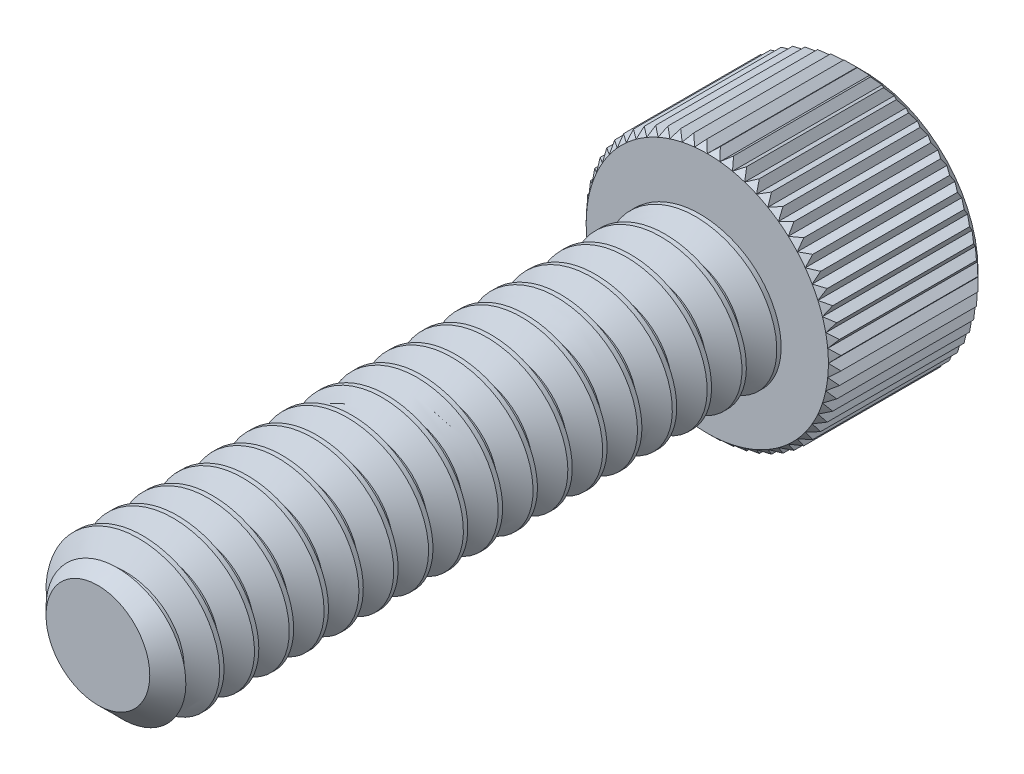
from build123d import *
from build123d.topology import SkipClean

# Parameters (mm, degrees)
SKETCH1_R          = 1.4224
EXTRUDE1_DEPTH     = 11.1125
CHAMFER3_SIZE      = 0.47625
CUT_SWEEP1_PITCH   = 0.635
SKETCH6_R          = 2.3241
EXTRUDE2_DEPTH     = 2.8448
CUT_EXTRUDE1_DEPTH = 1.7859375
CHAMFER1_SIZE      = 0.23241
CHAMFER2_SIZE      = 0.116205
CUT_EXTRUDE3_DEPTH = 12.588379528
CIRPATTERN1_COUNT  = 60


with BuildPart() as part:
    # Sketch1 → Extrude1 (new body)
    with BuildSketch(Plane.XY):
        Circle(SKETCH1_R)
    extrude(amount=-EXTRUDE1_DEPTH)

    # Chamfer3
    chamfer3_edges = [part.edges().sort_by_distance(p)[0] for p in [
        (-1.4224, 0, 0),
    ]]
    chamfer(chamfer3_edges, length=CHAMFER3_SIZE)

    # Cut-Sweep1: the profile of Sketch3 profile screwed along a right-hand helix of 18.5 turns, 6 arcs to a turn; built about Z, then put on its axis
    cut_sweep1_z = Axis((0, 0, 0), (0, 0, 1))
    cut_sweep1_corners = [(1.4227, 0, -0.555798205), (1.009955401, 0, -0.3175), (1.009955401, 0, -0.238125), (1.4227, 0, 0.000173205)]
    with BuildLine(mode=Mode.PRIVATE) as cut_sweep1_profile:
        Line(cut_sweep1_corners[0], cut_sweep1_corners[1])
        Line(cut_sweep1_corners[1], cut_sweep1_corners[2])
        Line(cut_sweep1_corners[2], cut_sweep1_corners[3])
        Line(cut_sweep1_corners[3], cut_sweep1_corners[0])
    cut_sweep1_cap = Face(cut_sweep1_profile.wire())
    cut_sweep1_turn_angles = [0, 30, 60, 90, 120, 150, 180, 210, 240, 270, 300, 330, 360]
    cut_sweep1_turn_weights = [1, 0.8660254037844387, 1, 0.8660254037844387, 1, 0.8660254037844387, 1, 0.8660254037844387, 1, 0.8660254037844387, 1, 0.8660254037844387, 1]
    cut_sweep1_turn_rails = [Edge.make_bspline([Vector(p[0], p[1], 0).rotate(cut_sweep1_z, cut_sweep1_turn_angles[k]) / cut_sweep1_turn_weights[k] + Vector(0, 0, p[2] + CUT_SWEEP1_PITCH * cut_sweep1_turn_angles[k] / 360) for k in range(13)], [0, 0, 0, 1, 1, 2, 2, 3, 3, 4, 4, 5, 5, 6, 6, 6], 2, cut_sweep1_turn_weights) for p in cut_sweep1_corners]
    cut_sweep1_turn_sides = [Face.make_surface_from_curves(cut_sweep1_turn_rails[p[0]], cut_sweep1_turn_rails[p[1]]) for p in [(0, 1), (1, 2), (2, 3), (3, 0)]]
    cut_sweep1_last_angles = [6480, 6510, 6540, 6570, 6600, 6630, 6660]
    cut_sweep1_last_weights = [1, 0.8660254037844387, 1, 0.8660254037844387, 1, 0.8660254037843553, 1]
    cut_sweep1_last_rails = [Edge.make_bspline([Vector(p[0], p[1], 0).rotate(cut_sweep1_z, cut_sweep1_last_angles[k]) / cut_sweep1_last_weights[k] + Vector(0, 0, p[2] + CUT_SWEEP1_PITCH * cut_sweep1_last_angles[k] / 360) for k in range(7)], [0, 0, 0, 1, 1, 2, 2, 3, 3, 3], 2, cut_sweep1_last_weights) for p in cut_sweep1_corners]
    cut_sweep1_last_sides = [Face.make_surface_from_curves(cut_sweep1_last_rails[p[0]], cut_sweep1_last_rails[p[1]]) for p in [(0, 1), (1, 2), (2, 3), (3, 0)]]
    cut_sweep1 = Plane(origin=(0, 0, 0), x_dir=(0, 1, 0), z_dir=(0, 0, -1)) * Solid(Shell([*[p.moved(Location((0, 0, CUT_SWEEP1_PITCH * i))) for i in range(18) for p in cut_sweep1_turn_sides], *cut_sweep1_last_sides, cut_sweep1_cap, cut_sweep1_cap.rotate(cut_sweep1_z, 6660).moved(Location((0, 0, CUT_SWEEP1_PITCH * 6660 / 360)))]))
    add(cut_sweep1, mode=Mode.SUBTRACT)

    # Sketch6 → Extrude2 (add)
    with BuildSketch(Plane(origin=(0, 0, -11.1125), x_dir=(-1, 0, 0), z_dir=(0, 0, -1))):
        Circle(SKETCH6_R)
    extrude(amount=EXTRUDE2_DEPTH)

    # Sketch7 → Cut-Extrude1 (cut)
    with BuildSketch(Plane(origin=(0, 0, -13.9573), x_dir=(-1, 0, 0), z_dir=(0, 0, -1))):
        Polygon((0, 1.374815329), (-1.190625, 0.687407664), (-1.190625, -0.687407664), (0, -1.374815329), (1.190625, -0.687407664), (1.190625, 0.687407664), align=None)
    extrude(amount=-CUT_EXTRUDE1_DEPTH, mode=Mode.SUBTRACT)

    # Cut-Extrude2 cone 1 section (through the dimple's axis) → Cut-Extrude2 (revolve, cut)
    with BuildSketch(Plane(origin=(0, 0, -13.9573), x_dir=(0, 1, 0), z_dir=(1, 0, 0))):
        Polygon((0, 0), (1.374815329, 0), (0, 1.374815329), align=None)
    revolve(axis=Axis((0, 0, -13.9573), (0, 0, 1)), mode=Mode.SUBTRACT)

    # Chamfer1
    chamfer1_edges = [part.edges().sort_by_distance(p)[0] for p in [
        (2.3241, 0, -13.9573),
    ]]
    chamfer(chamfer1_edges, length=CHAMFER1_SIZE)

    # Chamfer2
    chamfer2_edges = [part.edges().sort_by_distance(p)[0] for p in [
        (2.3241, 0, -11.1125),
    ]]
    chamfer(chamfer2_edges, length=CHAMFER2_SIZE)

    # Sketch10 → Cut-Extrude3 (cut, through all)
    with SkipClean():  # the faces are left unmerged after this step: merging them gives an invalid solid
        with BuildSketch(Plane.XY.offset(-11.1125)):
            Polygon((-0.250123709, 2.440305), (0, 2.207895), (0.250123709, 2.440305), align=None)
        cut_extrude3 = extrude(amount=-CUT_EXTRUDE3_DEPTH, mode=Mode.SUBTRACT)

    # CirPattern1: Cut-Extrude3 ×60 about axis
    cirpattern1_axis = Axis((0, 0, 0), (0, 0, 1))
    for i in range(1, CIRPATTERN1_COUNT):
        add(cut_extrude3.rotate(cirpattern1_axis, i * 360 / CIRPATTERN1_COUNT), mode=Mode.SUBTRACT)


solid = part.part
